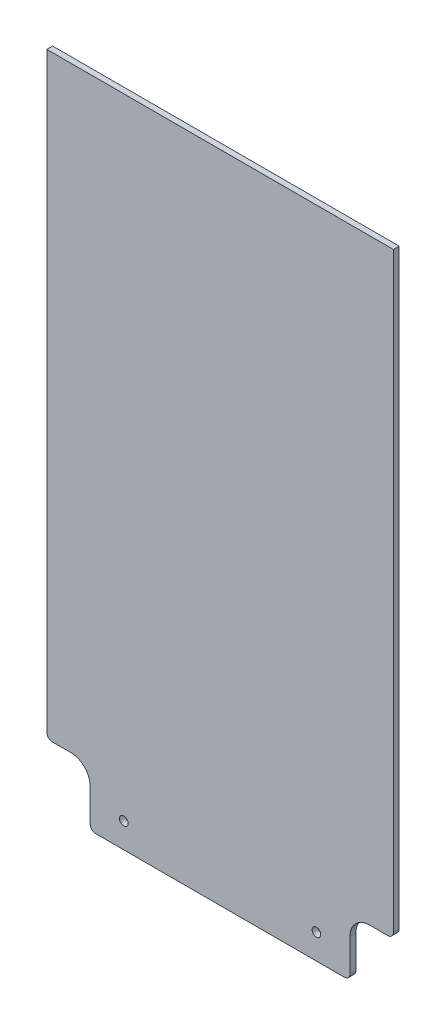
from build123d import *

# Parameters (mm, degrees)
ESQUISSE1_W                  = 180
ESQUISSE1_H                  = 340
BOSS_EXTRU_1_DEPTH           = 3
ENL_V_MAT_EXTRU_1_DEPTH      = 385.719378249
ENL_V_MAT_EXTRU_1_DEPTH_BACK = 385.719378249
ESQUISSE2_R                  = 2.25
ENL_V_MAT_EXTRU_2_DEPTH      = 385.719378249
ENL_V_MAT_EXTRU_2_DEPTH_BACK = 385.719378249
ESQUISSE3_W                  = 22.5
ESQUISSE3_H                  = 30
CONG_1_R                     = 10
CONG_2_R                     = 3


with BuildPart() as part:
    # Esquisse1 → Boss.-Extru.1 (new body)
    with BuildSketch(Plane.XY):
        with Locations((90, 170)):
            Rectangle(ESQUISSE1_W, ESQUISSE1_H)
    extrude(amount=BOSS_EXTRU_1_DEPTH)

    # Esquisse2 → Enlèv. mat.-Extru.1 (cut, two sides: drawn at the far end of the back side and taken through both)
    with BuildSketch(Plane.XY.offset(3).offset(-ENL_V_MAT_EXTRU_1_DEPTH_BACK)):
        with Locations((40, 13)):
            Circle(ESQUISSE2_R)
        with Locations((140, 13)):
            Circle(ESQUISSE2_R)
    extrude(amount=ENL_V_MAT_EXTRU_1_DEPTH + ENL_V_MAT_EXTRU_1_DEPTH_BACK, mode=Mode.SUBTRACT)

    # Esquisse3 → Enlèv. mat.-Extru.2 (cut, two sides: drawn at the far end of the back side and taken through both)
    with BuildSketch(Plane.XY.offset(3).offset(-ENL_V_MAT_EXTRU_2_DEPTH_BACK)):
        with Locations((11.25, 15)):
            Rectangle(ESQUISSE3_W, ESQUISSE3_H)
        with Locations((168.75, 15)):
            Rectangle(ESQUISSE3_W, ESQUISSE3_H)
    extrude(amount=ENL_V_MAT_EXTRU_2_DEPTH + ENL_V_MAT_EXTRU_2_DEPTH_BACK, mode=Mode.SUBTRACT)

    # Congé1
    cong_1_edges = [part.edges().sort_by_distance(p)[0] for p in [
        (157.5, 30, 1.5),
        (22.5, 30, 1.5),
    ]]
    fillet(cong_1_edges, radius=CONG_1_R)

    # Congé2
    cong_2_edges = [part.edges().sort_by_distance(p)[0] for p in [
        (0, 30, 1.5),
        (22.5, 0, 1.5),
        (180, 30, 1.5),
        (157.5, 0, 1.5),
    ]]
    fillet(cong_2_edges, radius=CONG_2_R)


solid = part.part
